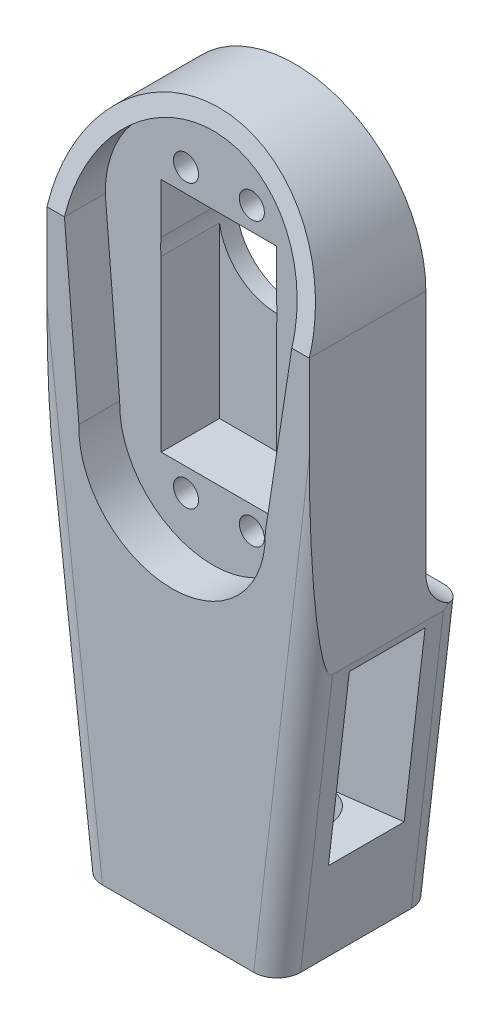
from build123d import *

# Parameters (mm, degrees)
BOSS_EXTRUDE1_DEPTH     = 10
CUT_EXTRUDE1_DEPTH      = 7
CUT_EXTRUDE3_DEPTH      = 55.838398955
CUT_EXTRUDE3_DEPTH_BACK = 55.838398955
BOSS_EXTRUDE2_DEPTH     = 27
SKETCH6_W               = 13
SKETCH6_H               = 30
CUT_EXTRUDE4_DEPTH      = 107.88879918
FILLET1_R               = 7
FILLET2_R               = 4
SKETCH8_R               = 6.5
CUT_EXTRUDE5_DEPTH      = 27
SKETCH11_R              = 2.15
SKETCH11_W              = 19.8
SKETCH11_H              = 40.5
CUT_EXTRUDE7_DEPTH      = 10
CUT_EXTRUDE8_DEPTH      = 101.056234307
CUT_EXTRUDE8_DEPTH_BACK = 101.056234307
SKETCH12_R              = 10


with BuildPart() as part:
    # Sketch1 → Boss-Extrude1 (new, symmetric)
    with BuildSketch(Plane.XY):
        with BuildLine():
            Line((22.5, 0), (22.5, -49))
            Line((22.5, -49), (-22.5, -49))
            Line((-22.5, -49), (-22.5, 0))
            ThreePointArc((-22.5, 0), (0, 22.5), (22.5, 0))
        make_face()
    extrude(amount=BOSS_EXTRUDE1_DEPTH, both=True)

    # Sketch2 → Cut-Extrude1 (cut)
    with BuildSketch(Plane.XY.offset(10)):
        with BuildLine():
            Line((-19.5, 0), (-17.029582922, -29.598102078))
            ThreePointArc((-17.029582922, -29.598102078), (-1.033858787, -46), (14.96028148, -29.596557582))
            Line((14.96028148, -29.596557582), (19.5, 0))
            ThreePointArc((19.5, 0), (0, 19.5), (-19.5, 0))
        make_face()
    extrude(amount=-CUT_EXTRUDE1_DEPTH, mode=Mode.SUBTRACT)

    # Sketch4 → Cut-Extrude3 (cut, two sides: drawn at the far end of the back side and taken through both)
    with BuildSketch(Plane.ZY.offset(-CUT_EXTRUDE3_DEPTH_BACK)):
        Polygon((10, 0), (10, 22.5), (3, 22.5), align=None)
    extrude(amount=CUT_EXTRUDE3_DEPTH + CUT_EXTRUDE3_DEPTH_BACK, mode=Mode.SUBTRACT)

    # Sketch5 → Boss-Extrude2 (add)
    with BuildSketch(Plane.XY.offset(10)):
        Polygon((-17, -96), (17, -96), (22.5, -49), (-22.5, -49), align=None)
    extrude(amount=-BOSS_EXTRUDE2_DEPTH)

    # Sketch6 → Cut-Extrude4 (cut, through all)
    with BuildSketch(Plane(origin=(-27.852629229, -3.259350229, 0), x_dir=(0, 0, 1), z_dir=(-0.9932225393212899, -0.11622816949504453, 0))):
        with Locations((-3.5, -67.373484893)):
            Rectangle(SKETCH6_W, SKETCH6_H)
    extrude(amount=-CUT_EXTRUDE4_DEPTH, mode=Mode.SUBTRACT)

    # Fillet1
    # the kernel refuses this fillet: 7 mm, written as the material it adds along each edge
    with BuildSketch(Plane(origin=(22.5, -49, -10), x_dir=(0, 1, 0), z_dir=(-1, 0, 0))) as fillet1_piece_1_section:
        with BuildLine():
            CenterArc((FILLET1_R, FILLET1_R), FILLET1_R, 180, 90)
            Line((0, FILLET1_R), (0, 0))
            Line((0, 0), (FILLET1_R, 0))
        make_face()
    fillet1_piece_1 = extrude(amount=45, mode=Mode.PRIVATE)
    fillet1_piece_1 = split(fillet1_piece_1, bisect_by=Plane(origin=(22.378999484, -50.034004412, -11.584712056), z_dir=(-0.9932225393212899, 0.11622816949504457, 0)), keep=Keep.TOP, mode=Mode.PRIVATE)
    fillet1_piece_1 = split(fillet1_piece_1, bisect_by=Plane(origin=(-22.378999484, -50.034004412, -11.584712056), z_dir=(0.9932225393212899, 0.11622816949504457, 0)), keep=Keep.TOP, mode=Mode.PRIVATE)
    add(fillet1_piece_1)

    # Fillet2
    fillet2_edges = [part.edges().sort_by_distance(p)[0] for p in [
        (19.75, -72.5, -17),
        (-19.75, -72.5, -17),
        (-19.75, -72.5, 10),
        (19.75, -72.5, 10),
    ]]
    fillet(fillet2_edges, radius=FILLET2_R)

    # Sketch8 → Cut-Extrude5 (cut)
    with BuildSketch(Plane.XZ.offset(96)):
        with Locations(Location((5.5, -3.5, 0), (0, 0, 270))):
            Circle(SKETCH8_R)
    extrude(amount=-CUT_EXTRUDE5_DEPTH, mode=Mode.SUBTRACT)

    # Sketch11 → Cut-Extrude7 (cut)
    with BuildSketch(Plane.XY.offset(3)):
        with Locations((5.65, 10.804521868)):
            Circle(SKETCH11_R)
        with Locations(Location((-5.65, 10.804521868, 0), (0, 0, 180))):
            Circle(SKETCH11_R)
        with Locations(Location((5.65, -37.595478132, 0), (0, 0, 180))):
            Circle(SKETCH11_R)
        with Locations((-5.65, -37.595478132)):
            Circle(SKETCH11_R)
        with Locations((0, -13.395478132)):
            Rectangle(SKETCH11_W, SKETCH11_H)
    extrude(amount=-CUT_EXTRUDE7_DEPTH, mode=Mode.SUBTRACT)

    # Sketch12 → Cut-Extrude8 (cut, two sides: drawn at the far end of the back side and taken through both)
    with BuildSketch(Plane.XY.offset(-7).offset(-CUT_EXTRUDE8_DEPTH_BACK)):
        with Locations((0, -3.145478132)):
            Circle(SKETCH12_R)
    extrude(amount=CUT_EXTRUDE8_DEPTH + CUT_EXTRUDE8_DEPTH_BACK, mode=Mode.SUBTRACT)


solid = part.part
